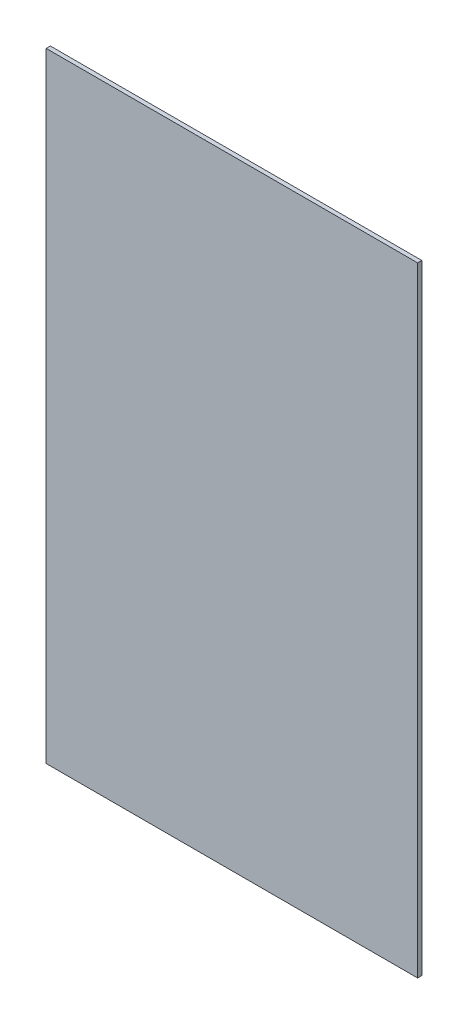
from build123d import *

# Parameters (mm, degrees)
SKETCH1_W           = 177.5
SKETCH1_H           = 296
BOSS_EXTRUDE1_DEPTH = 2


with BuildPart() as part:
    # Sketch1 → Boss-Extrude1 (new body)
    with BuildSketch(Plane.XY):
        with Locations((8.185679612, -83.699332524)):
            Rectangle(SKETCH1_W, SKETCH1_H)
    extrude(amount=BOSS_EXTRUDE1_DEPTH)


solid = part.part
